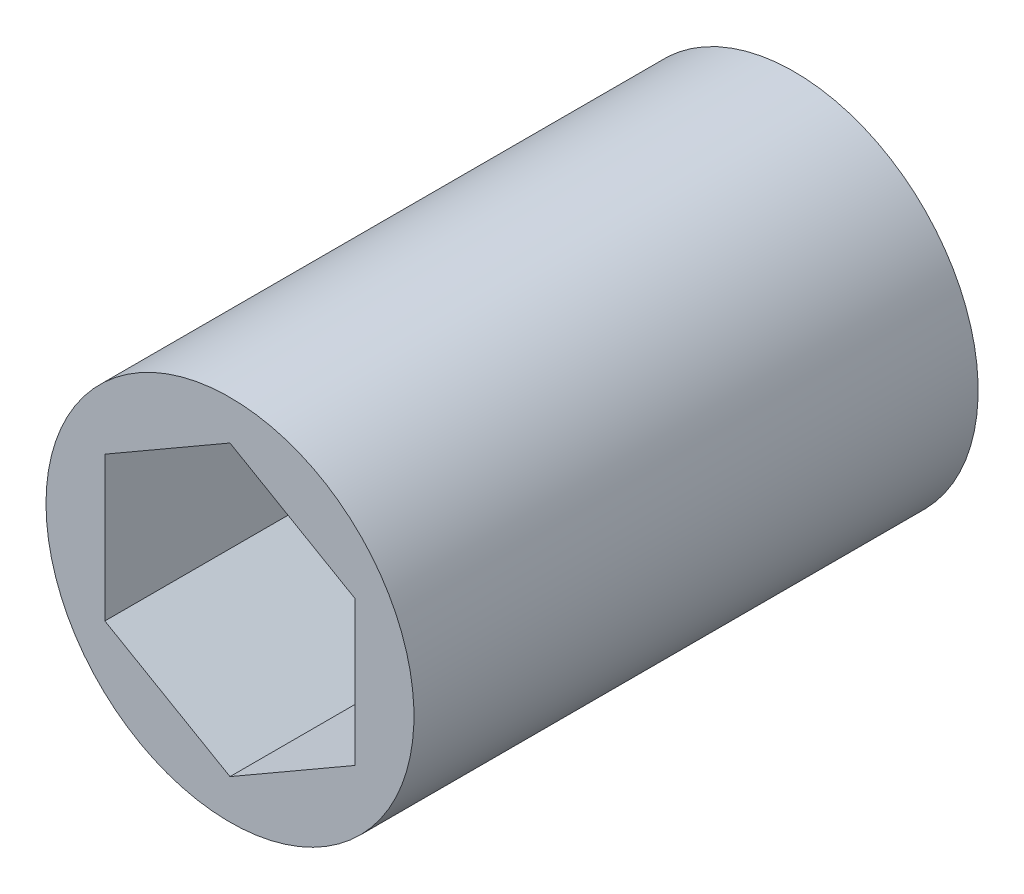
from build123d import *

# Parameters (mm, degrees)
SKETCH1_R           = 9.525
BOSS_EXTRUDE1_DEPTH = 14.605


with BuildPart() as part:
    # Sketch1 → Boss-Extrude1 (new, symmetric)
    with BuildSketch(Plane.XY):
        Circle(SKETCH1_R)
        Polygon((0, 7.478995387), (-6.477, 3.739497694), (-6.477, -3.739497694), (0, -7.478995387), (6.477, -3.739497694), (6.477, 3.739497694), align=None, mode=Mode.SUBTRACT)
    extrude(amount=BOSS_EXTRUDE1_DEPTH, both=True)


solid = part.part
